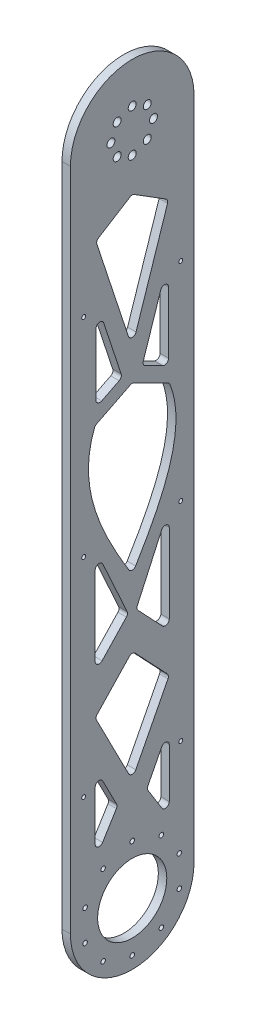
from build123d import *

# Parameters (mm, degrees)
SKETCH1_R           = 3
SKETCH1_R_2         = 1.7
SKETCH1_R_3         = 26
BOSS_EXTRUDE1_DEPTH = 6.35
CUT_EXTRUDE1_DEPTH  = 549.511460682
FILLET1_R           = 3
SKETCH4_R           = 1.5
CUT_EXTRUDE2_DEPTH  = 549.511460792


with BuildPart() as part:
    # Sketch1 → Boss-Extrude1 (new body)
    with BuildSketch(Plane(origin=(0, 0, 0), x_dir=(0, -1, 0), z_dir=(1, 0, 0))):
        with BuildLine():
            Line((500, 46.5), (0, 46.5))
            ThreePointArc((0, 46.5), (-46.5, 0), (0, -46.5))
            Line((0, -46.5), (500, -46.5))
            ThreePointArc((500, -46.5), (546.5, 0), (500, 46.5))
        make_face()
        with Locations((0, -16)):
            Circle(SKETCH1_R, mode=Mode.SUBTRACT)
        with Locations((-11.313708499, -11.313708499)):
            Circle(SKETCH1_R, mode=Mode.SUBTRACT)
        with Locations((11.313708499, -11.313708499)):
            Circle(SKETCH1_R, mode=Mode.SUBTRACT)
        with Locations((16, 0)):
            Circle(SKETCH1_R, mode=Mode.SUBTRACT)
        with Locations((488.48911696, -35.426855232)):
            Circle(SKETCH1_R_2, mode=Mode.SUBTRACT)
        with Locations((511.51088304, -35.426855232)):
            Circle(SKETCH1_R_2, mode=Mode.SUBTRACT)
        with Locations((469.86411696, -21.895000648)):
            Circle(SKETCH1_R_2, mode=Mode.SUBTRACT)
        with Locations((530.13588304, -21.895000648)):
            Circle(SKETCH1_R_2, mode=Mode.SUBTRACT)
        with Locations((462.75, 0)):
            Circle(SKETCH1_R_2, mode=Mode.SUBTRACT)
        with Locations((-16, 0)):
            Circle(SKETCH1_R, mode=Mode.SUBTRACT)
        with Locations((-11.313708499, 11.313708499)):
            Circle(SKETCH1_R, mode=Mode.SUBTRACT)
        with Locations((11.313708499, 11.313708499)):
            Circle(SKETCH1_R, mode=Mode.SUBTRACT)
        with Locations((0, 16)):
            Circle(SKETCH1_R, mode=Mode.SUBTRACT)
        with Locations((500, 0)):
            Circle(SKETCH1_R_3, mode=Mode.SUBTRACT)
        with Locations((537.25, 0)):
            Circle(SKETCH1_R_2, mode=Mode.SUBTRACT)
        with Locations((469.86411696, 21.895000648)):
            Circle(SKETCH1_R_2, mode=Mode.SUBTRACT)
        with Locations((530.13588304, 21.895000648)):
            Circle(SKETCH1_R_2, mode=Mode.SUBTRACT)
        with Locations((488.48911696, 35.426855232)):
            Circle(SKETCH1_R_2, mode=Mode.SUBTRACT)
        with Locations((511.51088304, 35.426855232)):
            Circle(SKETCH1_R_2, mode=Mode.SUBTRACT)
    extrude(amount=BOSS_EXTRUDE1_DEPTH)

    # Sketch3 → Cut-Extrude1 (cut, through all)
    with BuildSketch(Plane(origin=(6.35, 0, 0), x_dir=(0, 0, -1), z_dir=(1, 0, 0))):
        Polygon((0, -422.848022722), (27.858212922, -368.632839363), (0, -339.139268075), (-27.858212922, -368.632839363), align=None)
        Polygon((0, -41.368651369), (-27.312924288, -58.435222232), (0, -141.248998295), (27.312924288, -58.435222232), align=None)
        Polygon((3, -313.189087212), (27.858212922, -339.506549748), (27.858212922, -258.646044282), align=None)
        Polygon((-27.858212922, -339.506549748), (-27.858212922, -258.646044282), (-3, -313.189087212), align=None)
        Polygon((-27.858212922, -401.452857349), (-11, -434.260816252), (-27.858212922, -461.481824785), align=None)
        Polygon((11, -434.260816252), (27.858212922, -461.481824785), (27.858212922, -401.452857349), align=None)
        with BuildLine():
            Line((0, -164.248853344), (-27.858212922, -178.200474573))
            add(Edge.make_bspline(
                [(-27.858212922, -178.200474573), (-43.7790539, -216.093343216), (-18.61661693, -258.276071598), (0, -289.085024731)],
                knots=[0, 0, 0, 0, 1, 1, 1, 1], degree=3))
            add(Edge.make_bspline(
                [(27.858212922, -178.200474573), (43.7790539, -216.093343216), (18.61661693, -258.276071598), (0, -289.085024731)],
                knots=[0, 0, 0, 0, 1, 1, 1, 1], degree=3))
            Line((27.858212922, -178.200474573), (0, -164.248853344))
        make_face()
        Polygon((7.5, -156.820958214), (27.312924288, -96.747453897), (27.312924288, -166.743432993), align=None)
        Polygon((-27.312924288, -96.747453897), (-27.312924288, -166.743432993), (-7.5, -156.820958214), align=None)
    extrude(amount=-CUT_EXTRUDE1_DEPTH, mode=Mode.SUBTRACT)

    # Fillet1
    fillet1_edges = [part.edges().sort_by_distance(p)[0] for p in [
        (3.175, -58.435222232, -27.312924288),
        (3.175, -41.368651369, 0),
        (3.175, -58.435222232, 27.312924288),
        (3.175, -141.248998295, 0),
        (3.175, -289.085024731, 0),
        (3.175, -164.248853344, 0),
        (3.175, -401.452857349, 27.858212922),
        (3.175, -434.260816252, 11),
        (3.175, -461.481824785, 27.858212922),
        (3.175, -461.481824785, -27.858212922),
        (3.175, -434.260816252, -11),
        (3.175, -401.452857349, -27.858212922),
        (3.175, -368.632839363, -27.858212922),
        (3.175, -339.139268075, 0),
        (3.175, -368.632839363, 27.858212922),
        (3.175, -422.848022722, 0),
        (3.175, -313.189087212, 3),
        (3.175, -339.506549748, 27.858212922),
        (3.175, -258.646044282, 27.858212922),
        (3.175, -178.200474573, -27.858212922),
        (3.175, -178.200474573, 27.858212922),
        (3.175, -339.506549748, -27.858212922),
        (3.175, -313.189087212, -3),
        (3.175, -258.646044282, -27.858212922),
        (3.175, -96.747453897, 27.312924288),
        (3.175, -166.743432993, 27.312924288),
        (3.175, -156.820958214, 7.5),
        (3.175, -166.743432993, -27.312924288),
        (3.175, -156.820958214, -7.5),
        (3.175, -96.747453897, -27.312924288),
    ]]
    fillet(fillet1_edges, radius=FILLET1_R)

    # Sketch4 → Cut-Extrude2 (cut, through all)
    with BuildSketch(Plane(origin=(6.35, 0, 0), x_dir=(0, 0, -1), z_dir=(1, 0, 0))):
        with Locations((-36.5, -103.175)):
            Circle(SKETCH4_R)
        with Locations((36.5, -103.175)):
            Circle(SKETCH4_R)
        with Locations((-36.5, -259.525)):
            Circle(SKETCH4_R)
        with Locations((36.5, -259.525)):
            Circle(SKETCH4_R)
        with Locations((-36.5, -415.875)):
            Circle(SKETCH4_R)
        with Locations((36.5, -415.875)):
            Circle(SKETCH4_R)
    extrude(amount=-CUT_EXTRUDE2_DEPTH, mode=Mode.SUBTRACT)


solid = part.part
